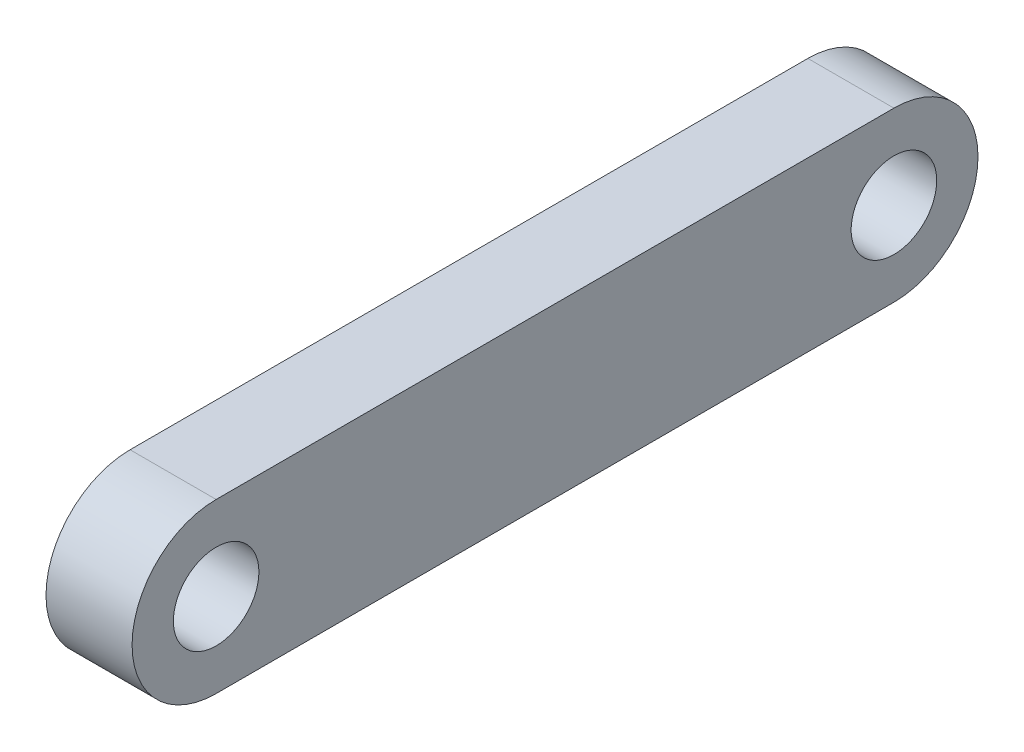
from build123d import *

# Parameters (mm, degrees)
SKETCH1_R           = 2.0193
BOSS_EXTRUDE1_DEPTH = 4.064


with BuildPart() as part:
    # Sketch1 → Boss-Extrude1 (new body)
    with BuildSketch(Plane(origin=(0, 0, 0), x_dir=(0, 0, -1), z_dir=(1, 0, 0))):
        with BuildLine():
            Line((0, 3.96875), (32, 3.96875))
            ThreePointArc((32, 3.96875), (35.96875, 0), (32, -3.96875))
            Line((32, -3.96875), (0, -3.96875))
            ThreePointArc((0, -3.96875), (-3.96875, 0), (0, 3.96875))
        make_face()
        Circle(SKETCH1_R, mode=Mode.SUBTRACT)
        with Locations((32, 0)):
            Circle(SKETCH1_R, mode=Mode.SUBTRACT)
    extrude(amount=BOSS_EXTRUDE1_DEPTH)


solid = part.part
